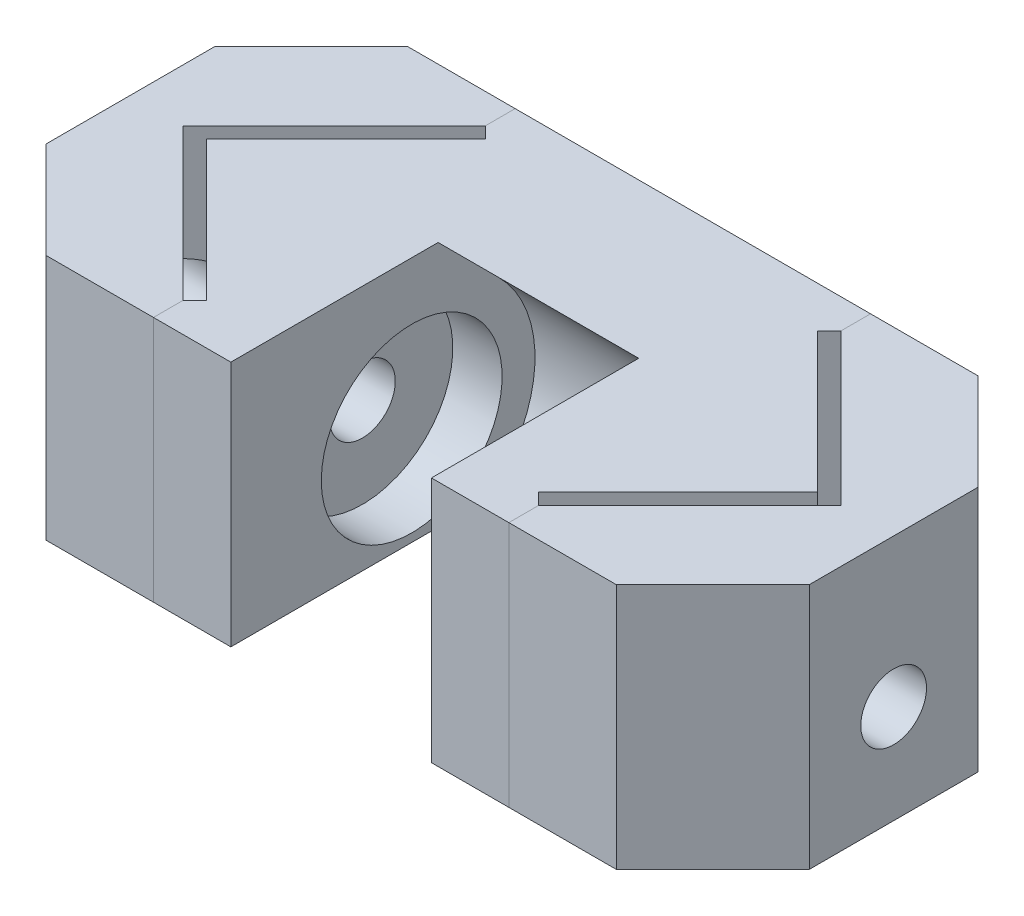
from build123d import *

# Parameters (mm, degrees)
BOSS_EXTRUDE1_DEPTH     = 15
BOSS_EXTRUDE2_DEPTH     = 15
SKETCH5_R               = 11
SKETCH5_R_2             = 4
CUT_EXTRUDE1_DEPTH      = 18.2
CUT_EXTRUDE2_DEPTH      = 54.517820911
CUT_EXTRUDE2_DEPTH_BACK = 54.517820911
SKETCH5_2_R             = 4
CUT_EXTRUDE3_START      = -12.2
CUT_EXTRUDE3_DEPTH      = 24.4


# Read off the part's stored shape, not the designer's step: Cut-Extrude3
with BuildPart() as part:
    # Sketch3 → Boss-Extrude1 (new, symmetric)
    with BuildSketch(Plane(origin=(0, 0, 0), x_dir=(1, 0, 0), z_dir=(0, 1, 0))):
        Polygon((37.171572875, 0), (20.201010127, 16.970562748), (21.615223689, 18.384776311), (21.615223689, 22), (12.2, 22), (-12.2, 22), (-21.615223689, 22), (-21.615223689, 18.384776311), (-20.201010127, 16.970562748), (-37.171572875, 0), (-20.201010127, -16.970562748), (-21.615223689, -18.384776311), (-21.615223689, -22), (-12.2, -22), (-12.2, 0), (12.2, 0), (12.2, -22), (21.615223689, -22), (21.615223689, -18.384776311), (20.201010127, -16.970562748), align=None)
    extrude(amount=BOSS_EXTRUDE1_DEPTH, both=True)

    # Sketch5 → Cut-Extrude1 (cut, symmetric)
    with BuildSketch(Plane.ZY):
        with Locations((0, -3)):
            Circle(SKETCH5_R)
        with Locations((0, -3)):
            Circle(SKETCH5_R_2, mode=Mode.SUBTRACT)
    extrude(amount=CUT_EXTRUDE1_DEPTH, both=True, mode=Mode.SUBTRACT)


with BuildPart() as body_2:
    # Sketch4 → Boss-Extrude2 (new, symmetric)
    with BuildSketch(Plane(origin=(0, 0, 0), x_dir=(1, 0, 0), z_dir=(0, 1, 0))):
        Polygon((21.615223689, 18.384776311), (21.615223689, 22), (34.687078818, 22), (46.423670202, 10.263408616), (46.423670202, -10.263408616), (34.687078818, -22), (21.615223689, -22), (21.615223689, -18.384776311), (40, 0), align=None)
    extrude(amount=BOSS_EXTRUDE2_DEPTH, both=True)


with BuildPart() as cut_extrude2_tool:
    # Sketch5<2> → Cut-Extrude2 (new, two sides: drawn at the far end of the back side and taken through both)
    with BuildSketch(Plane.ZY.offset(-CUT_EXTRUDE2_DEPTH_BACK)):
        with Locations(Location((0, -3, 0), (0, 0, 90))):
            Circle(SKETCH5_2_R)
    extrude(amount=CUT_EXTRUDE2_DEPTH + CUT_EXTRUDE2_DEPTH_BACK)


with BuildPart() as part_1:
    add(part.part)

    # Cut-Extrude2: cut by cut_extrude2_tool
    add(cut_extrude2_tool.part, mode=Mode.SUBTRACT)

    # Cut-Extrude3 outline → Cut-Extrude3 (cut)
    with BuildSketch(Plane(origin=(0, 0, 0), x_dir=(0, 0, -1), z_dir=(1, 0, 0)).offset(CUT_EXTRUDE3_START)):
        with BuildLine():
            Line((0, -15), (9.213203436, -15))
            Line((9.213203436, -15), (10.606601718, -13.606601718))
            ThreePointArc((10.606601718, -13.606601718), (15, -3), (10.606601718, 7.606601718))
            Line((10.606601718, 7.606601718), (3.213203436, 15))
            Line((3.213203436, 15), (0, 15))
            Line((0, 15), (0, 8))
            ThreePointArc((0, 8), (11, -3), (0, -14))
            Line((0, -14), (0, -15))
        make_face()
    extrude(amount=CUT_EXTRUDE3_DEPTH, mode=Mode.SUBTRACT)


with BuildPart() as body_2_1:
    add(body_2.part)

    # Cut-Extrude2: cut by cut_extrude2_tool
    add(cut_extrude2_tool.part, mode=Mode.SUBTRACT)


with BuildPart() as body_3:
    # Mirror1: mirrored copy
    add(body_2_1.part.mirror(Plane(origin=(0, 0, 0), x_dir=(0, 0, 1), z_dir=(1, 0, 0))))


solid = Compound([part_1.part, body_2_1.part, body_3.part])
